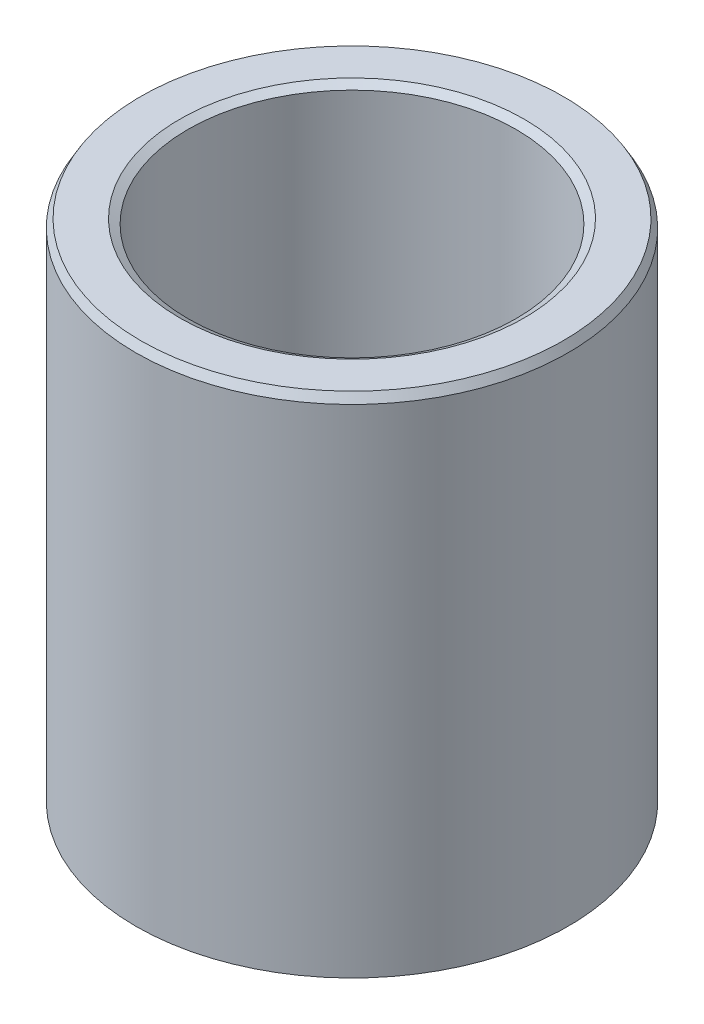
from build123d import *
from OCP.BRepFilletAPI import BRepFilletAPI_MakeChamfer

# Parameters (mm, degrees)
SKETCH1_R           = 22.5
BOSS_EXTRUDE1_DEPTH = 53.045559965
SKETCH2_R           = 17.072391741
CUT_EXTRUDE1_DEPTH  = 62.857347437
CHAMFER1_SIZE       = 0.852819278
CHAMFER1_SIZE2      = 0.49237544


with BuildPart() as part:
    # Sketch1 → Boss-Extrude1 (new body)
    with BuildSketch(Plane(origin=(0, 0, 0), x_dir=(1, 0, 0), z_dir=(0, 1, 0))):
        Circle(SKETCH1_R)
    extrude(amount=BOSS_EXTRUDE1_DEPTH)

    # Sketch2 → Cut-Extrude1 (cut, through all)
    with BuildSketch(Plane(origin=(0, 0, 0), x_dir=(1, 0, 0), z_dir=(0, 1, 0))):
        Circle(SKETCH2_R)
    extrude(amount=CUT_EXTRUDE1_DEPTH, mode=Mode.SUBTRACT)

    # Chamfer1: one chamfer whose edges measure the first distance from different faces: ONE call of the kernel's chamfer builder (chamfer() names one face for all edges)
    chamfer1_edges_1 = [part.edges().sort_by_distance(p)[0] for p in [
        (-17.072391741, 53.045559965, 0),
    ]]
    chamfer1_side_1 = [part.faces().sort_by_distance(p)[0] for p in [
        (-21.863603897, 53.045559965, 0),
    ]]
    chamfer1_edges_2 = [part.edges().sort_by_distance(p)[0] for p in [
        (-17.072391741, 0, 0),
    ]]
    chamfer1_side_2 = [part.faces().sort_by_distance(p)[0] for p in [
        (-17.072391741, 26.522779982, 0),
    ]]
    chamfer1_edges_3 = [part.edges().sort_by_distance(p)[0] for p in [
        (-22.5, 0, 0),
    ]]
    chamfer1_side_3 = [part.faces().sort_by_distance(p)[0] for p in [
        (-21.863603897, 0, 0),
    ]]
    chamfer1_edges_4 = [part.edges().sort_by_distance(p)[0] for p in [
        (-22.5, 53.045559965, 0),
    ]]
    chamfer1_side_4 = [part.faces().sort_by_distance(p)[0] for p in [
        (-22.5, 26.522779982, 0),
    ]]
    chamfer1 = BRepFilletAPI_MakeChamfer(part.part.solid().wrapped)
    for e in chamfer1_edges_1:
        chamfer1.Add(CHAMFER1_SIZE, CHAMFER1_SIZE2, e.wrapped, chamfer1_side_1[0].wrapped)  # the first distance lies on this face
    for e in chamfer1_edges_2:
        chamfer1.Add(CHAMFER1_SIZE, CHAMFER1_SIZE2, e.wrapped, chamfer1_side_2[0].wrapped)  # the first distance lies on this face
    for e in chamfer1_edges_3:
        chamfer1.Add(CHAMFER1_SIZE, CHAMFER1_SIZE2, e.wrapped, chamfer1_side_3[0].wrapped)  # the first distance lies on this face
    for e in chamfer1_edges_4:
        chamfer1.Add(CHAMFER1_SIZE, CHAMFER1_SIZE2, e.wrapped, chamfer1_side_4[0].wrapped)  # the first distance lies on this face
    add(Compound.cast(chamfer1.Shape()), mode=Mode.REPLACE)


solid = part.part
